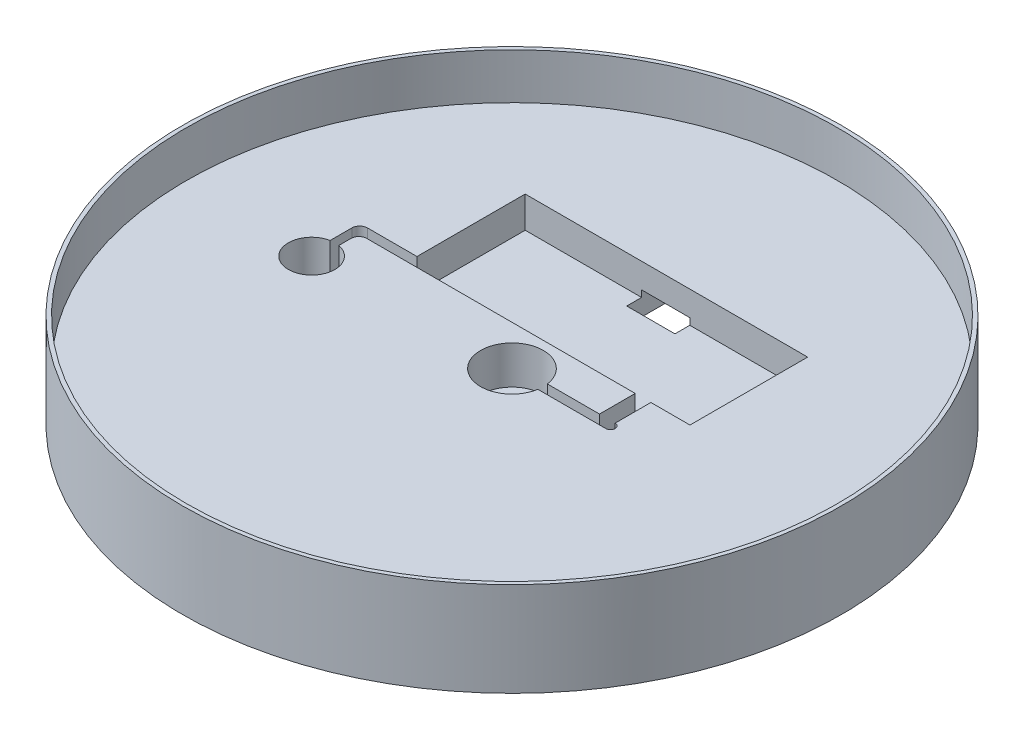
from build123d import *

# Parameters (mm, degrees)
SKETCH1_R           = 266.7
BOSS_EXTRUDE1_DEPTH = 76.2
SKETCH2_R           = 263.525
CUT_EXTRUDE1_DEPTH  = 37.084
SKETCH3_R           = 25.4
CUT_EXTRUDE2_DEPTH  = 30.988
CUT_EXTRUDE3_DEPTH  = 380.193672753
CUT_EXTRUDE12_DEPTH = 27.94
CUT_EXTRUDE13_DEPTH = 25.4
CUT_EXTRUDE14_DEPTH = 25.4
SKETCH21_W          = 38.994551816
SKETCH21_H          = 168.221568793
CUT_EXTRUDE15_DEPTH = 19.05


with BuildPart() as part:
    # Sketch1 → Boss-Extrude1 (new body)
    with BuildSketch(Plane(origin=(0, 0, 0), x_dir=(1, 0, 0), z_dir=(0, 1, 0))):
        Circle(SKETCH1_R)
    extrude(amount=BOSS_EXTRUDE1_DEPTH)

    # Sketch2 → Cut-Extrude1 (cut)
    with BuildSketch(Plane(origin=(0, 76.2, 0), x_dir=(1, 0, 0), z_dir=(0, 1, 0))):
        Circle(SKETCH2_R)
    extrude(amount=-CUT_EXTRUDE1_DEPTH, mode=Mode.SUBTRACT)

    # Sketch3 → Cut-Extrude2 (cut)
    with BuildSketch(Plane(origin=(0, 39.116, 0), x_dir=(1, 0, 0), z_dir=(0, 1, 0))):
        Circle(SKETCH3_R)
    extrude(amount=-CUT_EXTRUDE2_DEPTH, mode=Mode.SUBTRACT)

    # Sketch4 → Cut-Extrude3 (cut, through all)
    with BuildSketch(Plane(origin=(0, 39.116, 0), x_dir=(1, 0, 0), z_dir=(0, 1, 0))):
        with BuildLine():
            Line((3.81, 3.511669421), (80.01, 3.511669421))
            ThreePointArc((80.01, 3.511669421), (83.82, -0.298330579), (80.01, -4.108330579))
            Line((80.01, -4.108330579), (3.81, -4.108330579))
            ThreePointArc((3.81, -4.108330579), (0, -0.298330579), (3.81, 3.511669421))
        make_face()
    extrude(amount=-CUT_EXTRUDE3_DEPTH, mode=Mode.SUBTRACT)

    # Sketch15 → Cut-Extrude12 (cut)
    with BuildSketch(Plane(origin=(0, 39.116, 0), x_dir=(1, 0, 0), z_dir=(0, 1, 0))):
        with BuildLine():
            Line((-156.324841444, 16.153250023), (-156.324841444, 18.479175021))
            Line((-156.324841444, 18.479175021), (-163.351634066, 18.479175021))
            Line((-163.351634066, 18.479175021), (-163.351634066, 16.153250023))
            ThreePointArc((-163.351634066, 16.153250023), (-159.838237755, -21.107463957), (-156.324841444, 16.153250023))
        make_face()
    extrude(amount=-CUT_EXTRUDE12_DEPTH, mode=Mode.SUBTRACT)

    # Sketch19 → Cut-Extrude13 (cut)
    with BuildSketch(Plane(origin=(0, 39.116, 0), x_dir=(1, 0, 0), z_dir=(0, 1, 0))):
        Polygon((80.01, 3.511669421), (80.01, 32.408172399), (111.633958253, 32.408172399), (111.633958253, 127.658172399), (-116.966041747, 127.658172399), (-116.966041747, 32.408172399), (67.31, 32.408172399), (67.31, 3.511669421), align=None)
    extrude(amount=-CUT_EXTRUDE13_DEPTH, mode=Mode.SUBTRACT)

    # Sketch20 → Cut-Extrude14 (cut)
    with BuildSketch(Plane(origin=(0, 39.116, 0), x_dir=(1, 0, 0), z_dir=(0, 1, 0))):
        with BuildLine():
            Line((-116.966041747, 32.408172399), (-149.974841444, 32.408172399))
            ThreePointArc((-149.974841444, 32.408172399), (-154.464969504, 30.548300459), (-156.324841444, 26.058172399))
            Line((-156.324841444, 26.058172399), (-156.324841444, 18.479175021))
            Line((-156.324841444, 18.479175021), (-163.351634066, 18.479175021))
            Line((-163.351634066, 18.479175021), (-163.351634066, 33.721665135))
            ThreePointArc((-163.351634066, 33.721665135), (-161.491762127, 38.211793195), (-157.001634066, 40.071665135))
            Line((-157.001634066, 40.071665135), (-116.966041747, 40.071665135))
            Line((-116.966041747, 40.071665135), (-116.966041747, 32.408172399))
        make_face()
    extrude(amount=-CUT_EXTRUDE14_DEPTH, mode=Mode.SUBTRACT)

    # Sketch21 → Cut-Extrude15 (cut)
    with BuildSketch(Plane(origin=(0, 0, 0), x_dir=(-1, 0, 0), z_dir=(0, -1, 0))):
        with Locations((3.268316006, 199.749927686)):
            Rectangle(SKETCH21_W, SKETCH21_H)
    extrude(amount=-CUT_EXTRUDE15_DEPTH, mode=Mode.SUBTRACT)


solid = part.part
